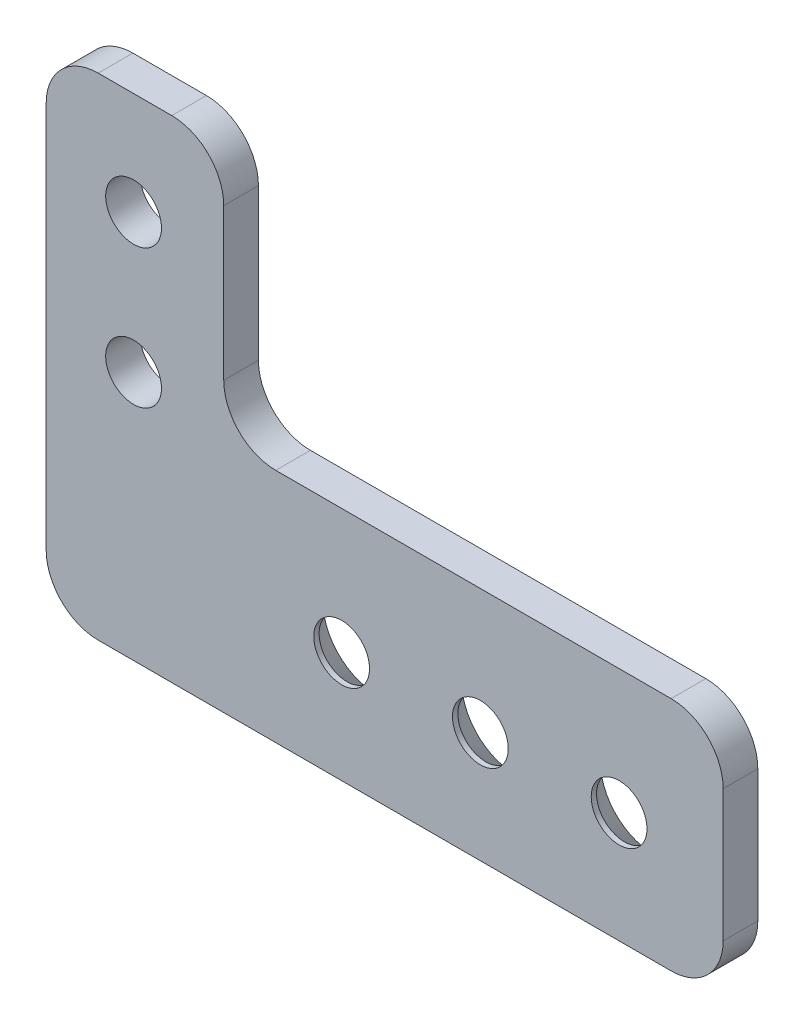
from build123d import *

# Parameters (mm, degrees)
SKETCH1_R                                    = 2.5527
BOSS_EXTRUDE1_DEPTH                          = 3.175
FILLET1_R                                    = 4.7625
CSK_FOR_10_FLAT_HEAD_MACHINE_SCREW3_AT_COUNT = 2
CSK_FOR_10_FLAT_HEAD_MACHINE_SCREW3_AT_PITCH = 12.7
CSK_FOR_10_FLAT_HEAD_MACHINE_SCREW3_2_COUNT  = 2
CSK_FOR_10_FLAT_HEAD_MACHINE_SCREW3_2_PITCH  = 25.4


with BuildPart() as part:
    # Sketch1 → Boss-Extrude1 (new body)
    with BuildSketch(Plane.XY):
        Polygon((-27.051, 23.749), (-27.051, -21.209), (34.925, -21.209), (34.925, 0.381), (-10.795, 0.381), (-10.795, 23.749), align=None)
        with Locations((-19.05, 1.651)):
            Circle(SKETCH1_R, mode=Mode.SUBTRACT)
        with Locations((-19.05, 14.351)):
            Circle(SKETCH1_R, mode=Mode.SUBTRACT)
    extrude(amount=BOSS_EXTRUDE1_DEPTH)

    # Fillet1
    fillet1_edges = [part.edges().sort_by_distance(p)[0] for p in [
        (-27.051, 23.749, 1.5875),
        (-10.795, 23.749, 1.5875),
        (-10.795, 0.381, 1.5875),
        (34.925, 0.381, 1.5875),
        (34.925, -21.209, 1.5875),
        (-27.051, -21.209, 1.5875),
    ]]
    fillet(fillet1_edges, radius=FILLET1_R)

    # Sketch7 → CSK for #10 Flat Head Machine Screw3 (revolve, cut)
    with BuildSketch(Plane(origin=(25.4, -11.049, 0), x_dir=(0, 1, 0), z_dir=(1, 0, 0))):
        Polygon((0, 0), (0, 3.175), (2.5527, 3.175), (2.5527, 2.688180894), (4.8895, 0), align=None)
    csk_for_10_flat_head_machine_screw3 = revolve(axis=Axis((25.4, -11.049, -6.35), (0, 0, 1)), mode=Mode.SUBTRACT)

    # CSK for #10 Flat Head Machine Screw3 at: CSK for #10 Flat Head Machine Screw3 ×2
    with Locations(*[(-i * CSK_FOR_10_FLAT_HEAD_MACHINE_SCREW3_AT_PITCH, 0, 0) for i in range(1, CSK_FOR_10_FLAT_HEAD_MACHINE_SCREW3_AT_COUNT)]):
        add(csk_for_10_flat_head_machine_screw3, mode=Mode.SUBTRACT)

    # CSK for _10 Flat Head Machine Screw3 2: CSK for #10 Flat Head Machine Screw3 ×2
    with Locations(*[(-i * CSK_FOR_10_FLAT_HEAD_MACHINE_SCREW3_2_PITCH, 0, 0) for i in range(1, CSK_FOR_10_FLAT_HEAD_MACHINE_SCREW3_2_COUNT)]):
        add(csk_for_10_flat_head_machine_screw3, mode=Mode.SUBTRACT)


solid = part.part
